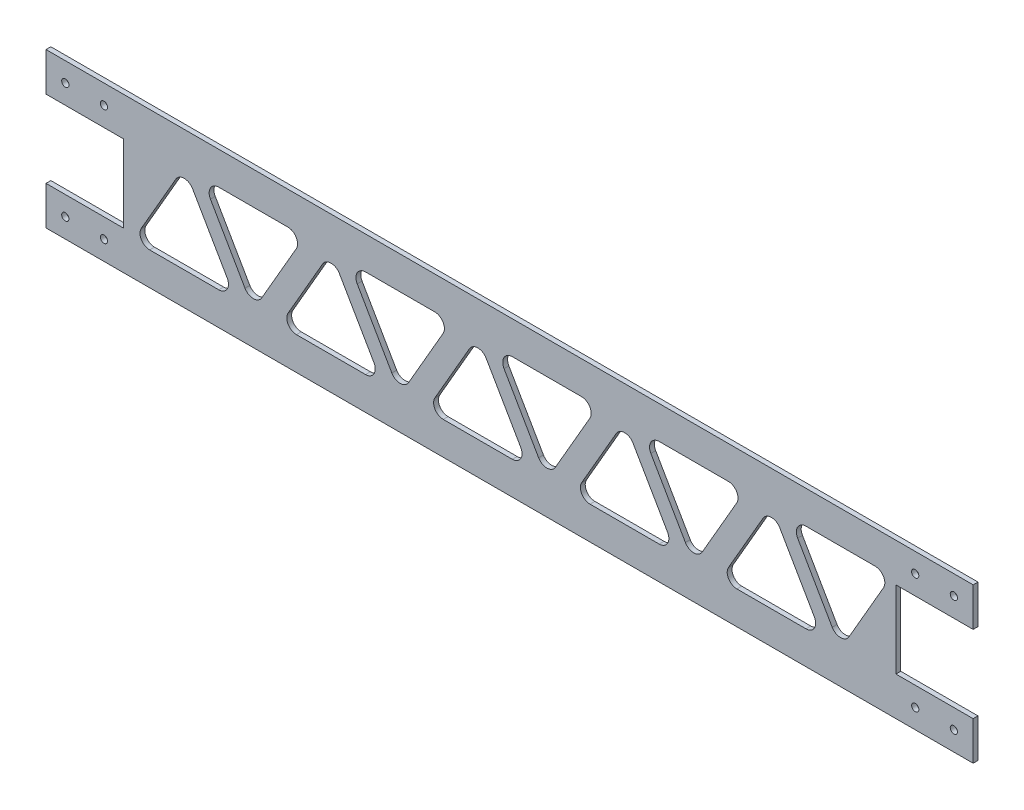
from build123d import *

# Parameters (mm, degrees)
SKETCH1_W           = 609.6
SKETCH1_H           = 101.6
BOSS_EXTRUDE1_DEPTH = 3.175
SKETCH2_R           = 2.38125
CUT_EXTRUDE1_DEPTH  = 310.020647571
CUT_EXTRUDE2_DEPTH  = 310.020647571
SKETCH4_W           = 50.8
SKETCH4_H           = 50.8
CUT_EXTRUDE3_DEPTH  = 310.020647571


with BuildPart() as part:
    # Sketch1 → Boss-Extrude1 (new body)
    with BuildSketch(Plane.XY):
        Rectangle(SKETCH1_W, SKETCH1_H)
    extrude(amount=BOSS_EXTRUDE1_DEPTH)

    # Sketch2 → Cut-Extrude1 (cut, through all)
    with BuildSketch(Plane.XY.offset(3.175)):
        with Locations((-292.1, 38.1)):
            Circle(SKETCH2_R)
        with Locations((-292.1, -38.1)):
            Circle(SKETCH2_R)
        with Locations((-266.7, 38.1)):
            Circle(SKETCH2_R)
        with Locations((-266.7, -38.1)):
            Circle(SKETCH2_R)
        with Locations((-292.1, -19.05)):
            Circle(SKETCH2_R)
        with Locations((-266.7, -19.05)):
            Circle(SKETCH2_R)
        with Locations((266.7, -19.05)):
            Circle(SKETCH2_R)
        with Locations((292.1, -19.05)):
            Circle(SKETCH2_R)
        with Locations((266.7, -38.1)):
            Circle(SKETCH2_R)
        with Locations((266.7, 38.1)):
            Circle(SKETCH2_R)
        with Locations((292.1, -38.1)):
            Circle(SKETCH2_R)
        with Locations((292.1, 38.1)):
            Circle(SKETCH2_R)
    extrude(amount=-CUT_EXTRUDE1_DEPTH, mode=Mode.SUBTRACT)

    # Sketch3 → Cut-Extrude2 (cut, through all)
    with BuildSketch(Plane.XY.offset(3.175)):
        with BuildLine():
            Line((-185.691655862, -19.685), (-208.42193596, 19.685))
            ThreePointArc((-208.42193596, 19.685), (-213.921197274, 22.86), (-219.420458588, 19.685))
            Line((-219.420458588, 19.685), (-242.150738686, -19.685))
            ThreePointArc((-242.150738686, -19.685), (-242.150738686, -26.035), (-236.651477372, -29.21))
            Line((-236.651477372, -29.21), (-191.190917176, -29.21))
            ThreePointArc((-191.190917176, -29.21), (-185.691655862, -26.035), (-185.691655862, -19.685))
        make_face()
        with BuildLine():
            Line((-162.961375764, -19.685), (-140.231095666, 19.685))
            ThreePointArc((-140.231095666, 19.685), (-140.231095666, 26.035), (-145.73035698, 29.21))
            Line((-145.73035698, 29.21), (-191.190917176, 29.21))
            ThreePointArc((-191.190917176, 29.21), (-196.69017849, 26.035), (-196.69017849, 19.685))
            Line((-196.69017849, 19.685), (-173.959898392, -19.685))
            ThreePointArc((-173.959898392, -19.685), (-168.460637078, -22.86), (-162.961375764, -19.685))
        make_face()
        with BuildLine():
            Line((-66.441375764, -19.685), (-43.711095666, 19.685))
            ThreePointArc((-43.711095666, 19.685), (-43.711095666, 26.035), (-49.21035698, 29.21))
            Line((-49.21035698, 29.21), (-94.670917176, 29.21))
            ThreePointArc((-94.670917176, 29.21), (-100.17017849, 26.035), (-100.17017849, 19.685))
            Line((-100.17017849, 19.685), (-77.439898392, -19.685))
            ThreePointArc((-77.439898392, -19.685), (-71.940637078, -22.86), (-66.441375764, -19.685))
        make_face()
        with BuildLine():
            Line((-140.131477372, -29.21), (-94.670917176, -29.21))
            ThreePointArc((-94.670917176, -29.21), (-89.171655862, -26.035), (-89.171655862, -19.685))
            Line((-89.171655862, -19.685), (-111.90193596, 19.685))
            ThreePointArc((-111.90193596, 19.685), (-117.401197274, 22.86), (-122.900458588, 19.685))
            Line((-122.900458588, 19.685), (-145.630738686, -19.685))
            ThreePointArc((-145.630738686, -19.685), (-145.630738686, -26.035), (-140.131477372, -29.21))
        make_face()
        with BuildLine():
            Line((30.078624236, -19.685), (52.808904334, 19.685))
            ThreePointArc((52.808904334, 19.685), (52.808904334, 26.035), (47.30964302, 29.21))
            Line((47.30964302, 29.21), (1.849082824, 29.21))
            ThreePointArc((1.849082824, 29.21), (-3.65017849, 26.035), (-3.65017849, 19.685))
            Line((-3.65017849, 19.685), (19.080101608, -19.685))
            ThreePointArc((19.080101608, -19.685), (24.579362922, -22.86), (30.078624236, -19.685))
        make_face()
        with BuildLine():
            Line((-43.611477372, -29.21), (1.849082824, -29.21))
            ThreePointArc((1.849082824, -29.21), (7.348344138, -26.035), (7.348344138, -19.685))
            Line((7.348344138, -19.685), (-15.38193596, 19.685))
            ThreePointArc((-15.38193596, 19.685), (-20.881197274, 22.86), (-26.380458588, 19.685))
            Line((-26.380458588, 19.685), (-49.110738686, -19.685))
            ThreePointArc((-49.110738686, -19.685), (-49.110738686, -26.035), (-43.611477372, -29.21))
        make_face()
        with BuildLine():
            Line((126.598624236, -19.685), (149.328904334, 19.685))
            ThreePointArc((149.328904334, 19.685), (149.328904334, 26.035), (143.82964302, 29.21))
            Line((143.82964302, 29.21), (98.369082824, 29.21))
            ThreePointArc((98.369082824, 29.21), (92.86982151, 26.035), (92.86982151, 19.685))
            Line((92.86982151, 19.685), (115.600101608, -19.685))
            ThreePointArc((115.600101608, -19.685), (121.099362922, -22.86), (126.598624236, -19.685))
        make_face()
        with BuildLine():
            Line((52.908522628, -29.21), (98.369082824, -29.21))
            ThreePointArc((98.369082824, -29.21), (103.868344138, -26.035), (103.868344138, -19.685))
            Line((103.868344138, -19.685), (81.13806404, 19.685))
            ThreePointArc((81.13806404, 19.685), (75.638802726, 22.86), (70.139541412, 19.685))
            Line((70.139541412, 19.685), (47.409261314, -19.685))
            ThreePointArc((47.409261314, -19.685), (47.409261314, -26.035), (52.908522628, -29.21))
        make_face()
        with BuildLine():
            Line((223.118624236, -19.685), (245.848904334, 19.685))
            ThreePointArc((245.848904334, 19.685), (245.848904334, 26.035), (240.34964302, 29.21))
            Line((240.34964302, 29.21), (194.889082824, 29.21))
            ThreePointArc((194.889082824, 29.21), (189.38982151, 26.035), (189.38982151, 19.685))
            Line((189.38982151, 19.685), (212.120101608, -19.685))
            ThreePointArc((212.120101608, -19.685), (217.619362922, -22.86), (223.118624236, -19.685))
        make_face()
        with BuildLine():
            Line((149.428522628, -29.21), (194.889082824, -29.21))
            ThreePointArc((194.889082824, -29.21), (200.388344138, -26.035), (200.388344138, -19.685))
            Line((200.388344138, -19.685), (177.65806404, 19.685))
            ThreePointArc((177.65806404, 19.685), (172.158802726, 22.86), (166.659541412, 19.685))
            Line((166.659541412, 19.685), (143.929261314, -19.685))
            ThreePointArc((143.929261314, -19.685), (143.929261314, -26.035), (149.428522628, -29.21))
        make_face()
    extrude(amount=-CUT_EXTRUDE2_DEPTH, mode=Mode.SUBTRACT)

    # Sketch4 → Cut-Extrude3 (cut, through all)
    with BuildSketch(Plane.XY.offset(3.175)):
        with Locations((-279.4, 0)):
            Rectangle(SKETCH4_W, SKETCH4_H)
        with Locations((279.4, 0)):
            Rectangle(SKETCH4_W, SKETCH4_H)
    extrude(amount=-CUT_EXTRUDE3_DEPTH, mode=Mode.SUBTRACT)


solid = part.part
